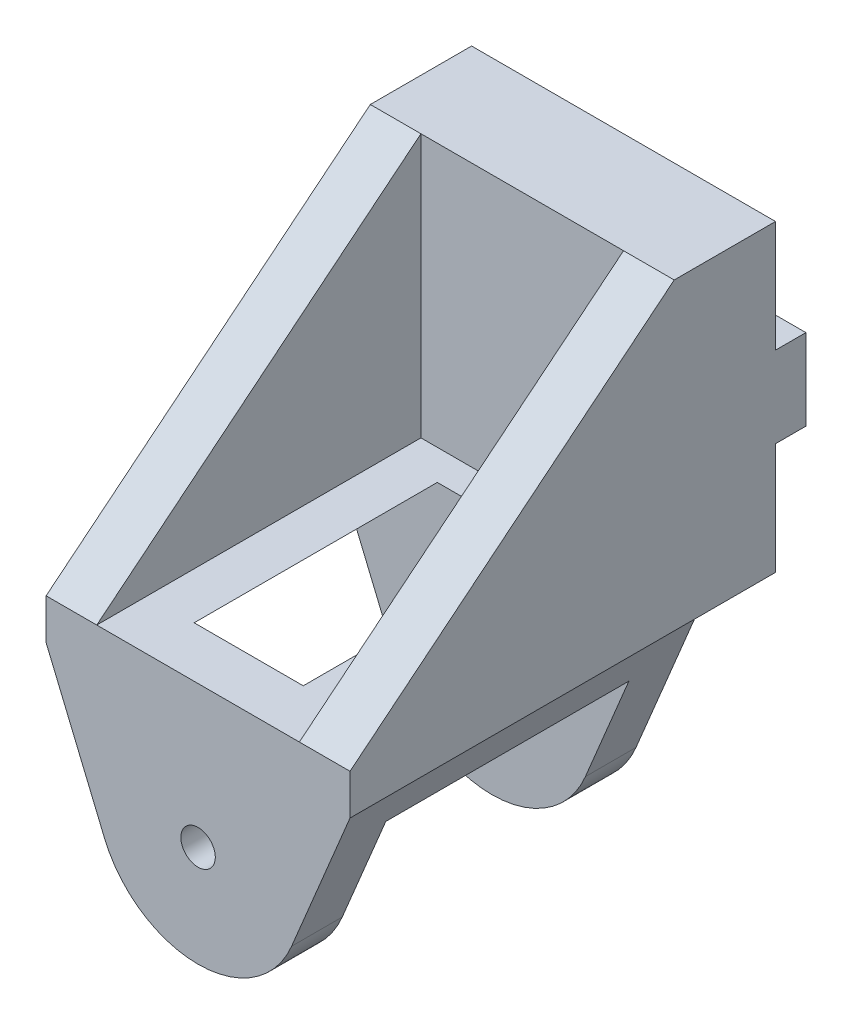
from build123d import *

# Parameters (mm, degrees)
EXTRUDE_1_DEPTH     = 42
SKETCH_2_R          = 15
CUT_EXTRUDE_1_DEPTH = 12
SKETCH_3_W          = 30
SKETCH_3_H          = 20
CUT_EXTRUDE_2_DEPTH = 8
SKETCH_4_W          = 5
SKETCH_4_H          = 8
EXTRUDE_2_DEPTH     = 3
OTHER_START         = 8
OTHER_1_OUTLINE_R   = 1.7
OTHER_1_DEPTH       = 34
SKETCH_7_W          = 20
SKETCH_7_H          = 32
CUT_EXTRUDE_6_DEPTH = 26
CUT_EXTRUDE_7_DEPTH = 60.699246226


# Read off the part's stored shape, not the designer's step: 高级异型孔1
with BuildPart() as part:
    # 草图1 → 凸台-拉伸1 (new body)
    with BuildSketch(Plane.XY):
        with BuildLine():
            Line((0, 0), (5.769230769, -13.846153846))
            ThreePointArc((5.769230769, -13.846153846), (15, -20), (24.230769231, -13.846153846))
            Line((24.230769231, -13.846153846), (30, 0))
            Line((30, 0), (30, 30))
            Line((30, 30), (0, 30))
            Line((0, 30), (0, 0))
        make_face()
    extrude(amount=EXTRUDE_1_DEPTH)

    # 草图2 → 切除-拉伸1 (cut, symmetric)
    with BuildSketch(Plane(origin=(0, 0, 25), x_dir=(-1, 0, 0), z_dir=(0, 0, -1))):
        with Locations((-15, -10)):
            Circle(SKETCH_2_R)
    extrude(amount=CUT_EXTRUDE_1_DEPTH, both=True, mode=Mode.SUBTRACT)

    # 草图3 → 切除-拉伸2 (cut)
    with BuildSketch(Plane(origin=(0, 0, 0), x_dir=(-1, 0, 0), z_dir=(0, 0, -1))):
        with Locations((-15, -10)):
            Rectangle(SKETCH_3_W, SKETCH_3_H)
    extrude(amount=-CUT_EXTRUDE_2_DEPTH, mode=Mode.SUBTRACT)

    # 草图4 → 凸台-拉伸2 (add)
    with BuildSketch(Plane(origin=(0, 0, 0), x_dir=(-1, 0, 0), z_dir=(0, 0, -1))):
        with Locations((-27.5, 15)):
            Rectangle(SKETCH_4_W, SKETCH_4_H)
        with Locations((-2.5, 15)):
            Rectangle(SKETCH_4_W, SKETCH_4_H)
    extrude(amount=EXTRUDE_2_DEPTH)

    # 高级异型孔1 outline → 高级异型孔1 (cut)
    with BuildSketch(Plane.XY.offset(OTHER_START)):
        with Locations((15, -10)):
            Circle(OTHER_1_OUTLINE_R)
    extrude(amount=OTHER_1_DEPTH, mode=Mode.SUBTRACT)

    # 草图7 → 切除-拉伸6 (cut)
    with BuildSketch(Plane(origin=(0, 30, 0), x_dir=(1, 0, 0), z_dir=(0, 1, 0))):
        with Locations((15, -26)):
            Rectangle(SKETCH_7_W, SKETCH_7_H)
    extrude(amount=-CUT_EXTRUDE_6_DEPTH, mode=Mode.SUBTRACT)

    # 草图8 → 切除-拉伸7 (cut, through all)
    with BuildSketch(Plane(origin=(30, 0, 0), x_dir=(0, 0, -1), z_dir=(1, 0, 0))):
        Polygon((-42, 30), (-10, 30), (-42, 4), align=None)
    extrude(amount=-CUT_EXTRUDE_7_DEPTH, mode=Mode.SUBTRACT)


solid = part.part
